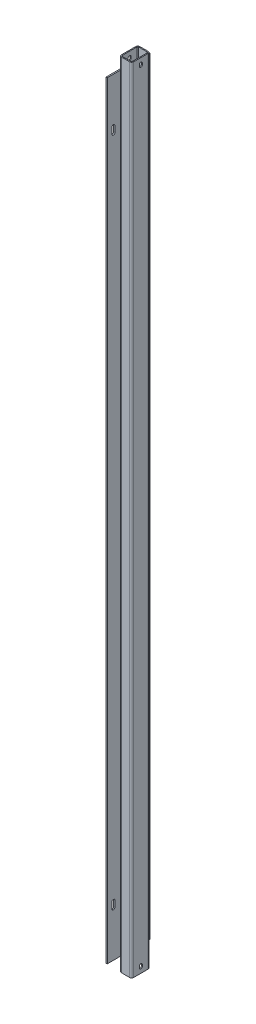
from build123d import *

# Parameters (mm, degrees)
MEMBER_1_DEPTH         = 2600
SKETCH_3_W             = 140
SKETCH_3_H             = 2516
SM_BASE_FLANGE_1_DEPTH = 4
CUT_EXTRUDE_1_DEPTH    = 1303.626577343
CUT_EXTRUDE_5_DEPTH    = 499


# Sheet-metal steps are written as plain solids
with BuildPart() as part:
    # Sketch1 → Member 1 (new body)
    with BuildSketch(Plane.XZ.offset(-1300)):
        with BuildLine():
            Line((-13.6, -30), (13.6, -30))
            ThreePointArc((13.6, -30), (18.1254834, -28.1254834), (20, -23.6))
            Line((20, -23.6), (20, 23.6))
            ThreePointArc((20, 23.6), (18.1254834, 28.1254834), (13.6, 30))
            Line((13.6, 30), (-13.6, 30))
            ThreePointArc((-13.6, 30), (-18.1254834, 28.1254834), (-20, 23.6))
            Line((-20, 23.6), (-20, -23.6))
            ThreePointArc((-20, -23.6), (-18.1254834, -28.1254834), (-13.6, -30))
        make_face()
        with BuildLine():
            Line((-13.6, -26.8), (13.6, -26.8))
            ThreePointArc((13.6, -26.8), (15.8627417, -25.8627417), (16.8, -23.6))
            Line((16.8, -23.6), (16.8, 23.6))
            ThreePointArc((16.8, 23.6), (15.8627417, 25.8627417), (13.6, 26.8))
            Line((13.6, 26.8), (-13.6, 26.8))
            ThreePointArc((-13.6, 26.8), (-15.8627417, 25.8627417), (-16.8, 23.6))
            Line((-16.8, 23.6), (-16.8, -23.6))
            ThreePointArc((-16.8, -23.6), (-15.8627417, -25.8627417), (-13.6, -26.8))
        make_face(mode=Mode.SUBTRACT)
    extrude(amount=MEMBER_1_DEPTH)

    # 草图4 → 切除-拉伸1 (cut, through all)
    with BuildSketch(Plane(origin=(20, 0, 0), x_dir=(0, 0, -1), z_dir=(1, 0, 0))):
        with BuildLine():
            Line((-5, -1282.5), (-5, -1277.5))
            ThreePointArc((-5, -1277.5), (0, -1272.5), (5, -1277.5))
            Line((5, -1277.5), (5, -1282.5))
            ThreePointArc((5, -1282.5), (0, -1287.5), (-5, -1282.5))
        make_face()
        with BuildLine():
            Line((-5, 1277.5), (-5, 1282.5))
            ThreePointArc((-5, 1282.5), (0, 1287.5), (5, 1282.5))
            Line((5, 1282.5), (5, 1277.5))
            ThreePointArc((5, 1277.5), (0, 1272.5), (-5, 1277.5))
        make_face()
    extrude(amount=-CUT_EXTRUDE_1_DEPTH, mode=Mode.SUBTRACT)


with BuildPart() as body_2:
    # 草图3 → 基体-法兰1 (new body)
    with BuildSketch(Plane.ZY.offset(20)):
        Rectangle(SKETCH_3_W, SKETCH_3_H)
    extrude(amount=SM_BASE_FLANGE_1_DEPTH)

    # 草图8 → 切除-拉伸5 (cut)
    with BuildSketch(Plane.ZY.offset(24)):
        with BuildLine():
            Line((55, 1110.000000001), (55, 1090.000000001))
            ThreePointArc((55, 1090.000000001), (50, 1085.000000001), (45, 1090.000000001))
            Line((45, 1090.000000001), (45, 1110.000000001))
            ThreePointArc((45, 1110.000000001), (50, 1115.000000001), (55, 1110.000000001))
        make_face()
        with BuildLine():
            Line((55, -1089.999999999), (55, -1109.999999999))
            ThreePointArc((55, -1109.999999999), (50, -1114.999999999), (45, -1109.999999999))
            Line((45, -1109.999999999), (45, -1089.999999999))
            ThreePointArc((45, -1089.999999999), (50, -1084.999999999), (55, -1089.999999999))
        make_face()
        with BuildLine():
            Line((-55, -1089.999999999), (-55, -1109.999999999))
            ThreePointArc((-55, -1109.999999999), (-50, -1114.999999999), (-45, -1109.999999999))
            Line((-45, -1109.999999999), (-45, -1089.999999999))
            ThreePointArc((-45, -1089.999999999), (-50, -1084.999999999), (-55, -1089.999999999))
        make_face()
        with BuildLine():
            Line((-55, 1110.000000001), (-55, 1090.000000001))
            ThreePointArc((-55, 1090.000000001), (-50, 1085.000000001), (-45, 1090.000000001))
            Line((-45, 1090.000000001), (-45, 1110.000000001))
            ThreePointArc((-45, 1110.000000001), (-50, 1115.000000001), (-55, 1110.000000001))
        make_face()
    extrude(amount=-CUT_EXTRUDE_5_DEPTH, mode=Mode.SUBTRACT)


solid = Compound([part.part, body_2.part])
